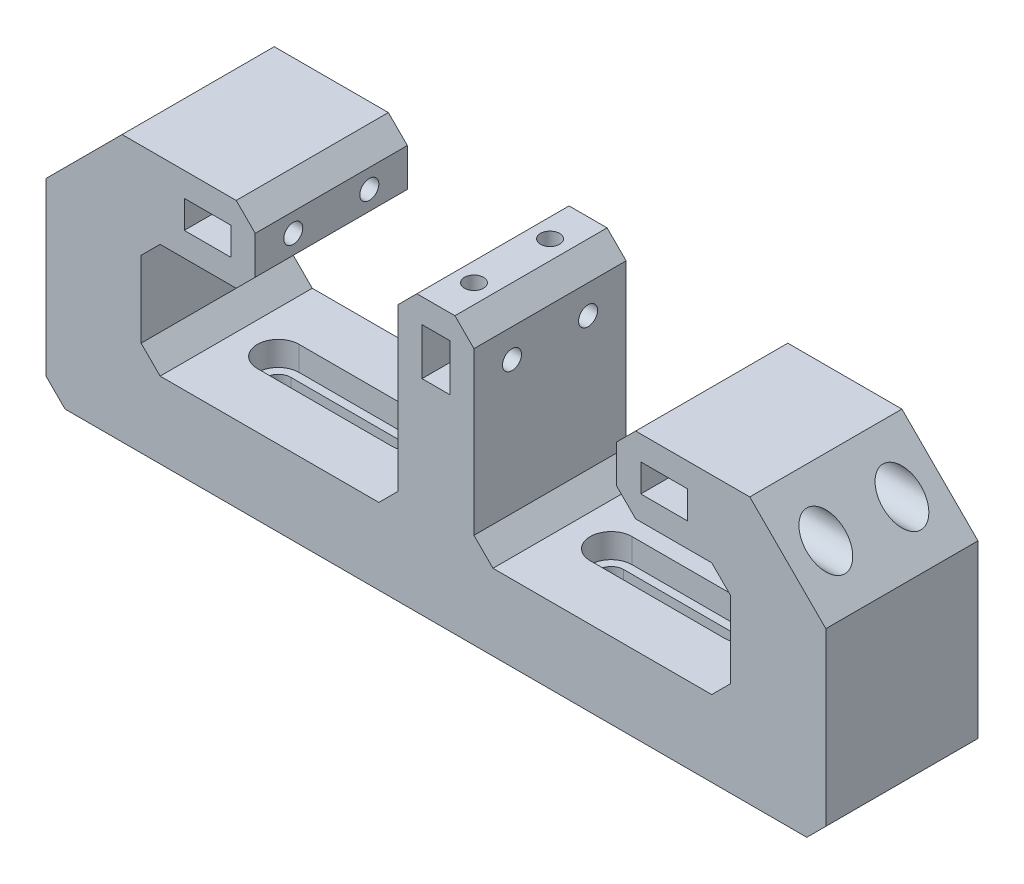
from build123d import *

# Parameters (mm, degrees)
SKETCH_1_W                  = 12.3
SKETCH_1_H                  = 7.3
SKETCH_1_W_2                = 7.3
SKETCH_1_H_2                = 12.3
EXTRUDE_1_DEPTH             = 40
CHAMFER_1_SIZE              = 5
CHAMFER_2_SIZE              = 5
CHAMFER_3_SIZE              = 5
SKETCH_25_R                 = 5
CUT_EXTRUDE_1452_DEPTH      = 15
SKETCH_26_R                 = 2.5
CUT_EXTRUDE_1599_DEPTH      = 132.766839531
SKETCH_23_R                 = 5
CUT_EXTRUDE_1755_DEPTH      = 25
CUT_EXTRUDE_1893_REACH      = 219.313
SKETCH_24_R                 = 2.5
MIRROR_2083_COPY_1_SKETCH_R = 5
MIRROR_2083_COPY_1_DEPTH    = 25
MIRROR_2083_COPY_2_REACH    = 219.313
MIRROR_2083_COPY_2_SKETCH_R = 2.5
HOLE_START                  = -60
HOLE_WIZARD_M6_2_DEPTH      = 20
HOLE_START_2                = -46.4
HOLE_WIZARD_M6_2_2_DEPTH    = 6.4


# Read off the part's stored shape, not the designer's step: M6 六角承窩頭蓋螺釘的柱孔2
with BuildPart() as part:
    # 草圖1 → 填料-伸長1 (new body)
    with BuildSketch(Plane.XY):
        Polygon((-82.5, 10), (-47.5, 10), (-47.5, -10), (-77.5, -10), (-77.5, -40), (-10, -40), (-10, 12.5), (10, 12.5), (10, -40), (77.5, -40), (77.5, -10), (47.5, -10), (47.5, 10), (82.5, 10), (102.5, -10), (102.5, -60), (-102.5, -60), (-102.5, -10), align=None)
        with Locations((60, 0)):
            Rectangle(SKETCH_1_W, SKETCH_1_H, mode=Mode.SUBTRACT)
        with Locations((-60, 0)):
            Rectangle(SKETCH_1_W, SKETCH_1_H, mode=Mode.SUBTRACT)
        Rectangle(SKETCH_1_W_2, SKETCH_1_H_2, mode=Mode.SUBTRACT)
    extrude(amount=EXTRUDE_1_DEPTH)

    # 導角1
    chamfer_1_edges = [part.edges().sort_by_distance(p)[0] for p in [
        (-47.5, -10, 20),
        (-10, 12.5, 20),
        (10, 12.5, 20),
        (47.5, -10, 20),
        (47.5, 10, 20),
        (-47.5, 10, 20),
    ]]
    chamfer(chamfer_1_edges, length=CHAMFER_1_SIZE)

    # 導角2
    chamfer_2_edges = [part.edges().sort_by_distance(p)[0] for p in [
        (-77.5, -10, 20),
        (-77.5, -40, 20),
        (-10, -40, 20),
        (10, -40, 20),
        (77.5, -40, 20),
        (77.5, -10, 20),
    ]]
    chamfer(chamfer_2_edges, length=CHAMFER_2_SIZE)

    # 導角3
    chamfer_3_edges = [part.edges().sort_by_distance(p)[0] for p in [
        (102.5, -60, 20),
        (-102.5, -60, 20),
    ]]
    chamfer(chamfer_3_edges, length=CHAMFER_3_SIZE)

    # 草圖25 → Cut-Extrude 1452 (cut)
    with BuildSketch(Plane(origin=(0, -60, 0), x_dir=(-1, 0, 0), z_dir=(0, -1, 0))):
        with Locations(Location((0, -10, 0), (0, 0, 180))):
            Circle(SKETCH_25_R)
    cut_extrude_1452 = extrude(amount=-CUT_EXTRUDE_1452_DEPTH, mode=Mode.SUBTRACT)

    # 草圖26 → Cut-Extrude 1599 (cut, through all)
    with BuildSketch(Plane(origin=(0, -60, 0), x_dir=(-1, 0, 0), z_dir=(0, -1, 0))):
        with Locations(Location((0, -10, 0), (0, 0, 180))):
            Circle(SKETCH_26_R)
    cut_extrude_1599 = extrude(amount=-CUT_EXTRUDE_1599_DEPTH, mode=Mode.SUBTRACT)

    # Mirror 1698: Cut-Extrude 1452, Cut-Extrude 1599 across plane
    add(cut_extrude_1452.mirror(Plane(origin=(0, 0, 20), x_dir=(1, 0, 0), z_dir=(0, 0, -1))), mode=Mode.SUBTRACT)
    add(cut_extrude_1599.mirror(Plane(origin=(0, 0, 20), x_dir=(1, 0, 0), z_dir=(0, 0, -1))), mode=Mode.SUBTRACT)

    # 草圖23 → Cut-Extrude 1755 (cut)
    with BuildSketch(Plane(origin=(102.5, 0, 0), x_dir=(0, 0, -1), z_dir=(1, 0, 0))):
        with Locations(Location((-10, 0, 0), (0, 0, 90))):
            Circle(SKETCH_23_R)
    cut_extrude_1755 = extrude(amount=-CUT_EXTRUDE_1755_DEPTH, mode=Mode.SUBTRACT)

    # Cut-Extrude 1893: up to this face of the body (flat: up to its plane)
    cut_extrude_1893_end = Plane(part.part.faces().sort_by_distance((3.65, 0, 20))[0])
    # 草圖24 → Cut-Extrude 1893 (cut, up to the picked face)
    with BuildSketch(Plane(origin=(102.5, 0, 0), x_dir=(0, 0, -1), z_dir=(1, 0, 0)), mode=Mode.PRIVATE) as cut_extrude_1893_sk1:
        with Locations(Location((-10, 0, 0), (0, 0, 90))):
            Circle(SKETCH_24_R)
    cut_extrude_1893_tool1 = split(extrude(cut_extrude_1893_sk1.sketch, amount=-CUT_EXTRUDE_1893_REACH, mode=Mode.PRIVATE), bisect_by=cut_extrude_1893_end, keep=Keep.BOTH, mode=Mode.PRIVATE)
    cut_extrude_1893 = cut_extrude_1893_tool1.solids().sort_by(Axis((102.5, 0, 10), (-1, 0, 0)))[0]
    add(cut_extrude_1893, mode=Mode.SUBTRACT)

    # Mirror 2006: Cut-Extrude 1755, Cut-Extrude 1893 across plane
    add(cut_extrude_1755.mirror(Plane.ZY), mode=Mode.SUBTRACT)
    add(cut_extrude_1893.mirror(Plane.ZY), mode=Mode.SUBTRACT)

    # Mirror 2083: Cut-Extrude 1755, Cut-Extrude 1893 across plane
    add(cut_extrude_1755.mirror(Plane(origin=(0, 0, 20), x_dir=(1, 0, 0), z_dir=(0, 0, -1))), mode=Mode.SUBTRACT)
    add(cut_extrude_1893.mirror(Plane(origin=(0, 0, 20), x_dir=(1, 0, 0), z_dir=(0, 0, -1))), mode=Mode.SUBTRACT)

    # Mirror 2083 copy 1 sketch → Mirror 2083 copy 1 (cut)
    with BuildSketch(Plane(origin=(-102.5, 0, 40), x_dir=(0, 0, 1), z_dir=(-1, 0, 0))):
        with Locations(Location((-10, 0, 0), (0, 0, 90))):
            Circle(MIRROR_2083_COPY_1_SKETCH_R)
    extrude(amount=-MIRROR_2083_COPY_1_DEPTH, mode=Mode.SUBTRACT)

    # Mirror 2083 copy 2: up to this face of the body (flat: up to its plane)
    mirror_2083_copy_2_end = Plane(part.part.faces().sort_by_distance((-3.65, 0, 20))[0])
    # Mirror 2083 copy 2 sketch → Mirror 2083 copy 2 (cut, up to the picked face)
    with BuildSketch(Plane(origin=(-102.5, 0, 40), x_dir=(0, 0, 1), z_dir=(-1, 0, 0)), mode=Mode.PRIVATE) as mirror_2083_copy_2_sk1:
        with Locations(Location((-10, 0, 0), (0, 0, 90))):
            Circle(MIRROR_2083_COPY_2_SKETCH_R)
    mirror_2083_copy_2_tool1 = split(extrude(mirror_2083_copy_2_sk1.sketch, amount=-MIRROR_2083_COPY_2_REACH, mode=Mode.PRIVATE), bisect_by=mirror_2083_copy_2_end, keep=Keep.BOTH, mode=Mode.PRIVATE)
    add(mirror_2083_copy_2_tool1.solids().sort_by(Axis((-102.5, 0, 30), (1, 0, 0)))[0], mode=Mode.SUBTRACT)

    # M6 六角承窩頭蓋螺釘的柱孔2 outline → M6 六角承窩頭蓋螺釘的柱孔2 (cut)
    with BuildSketch(Plane(origin=(0, 0, 0), x_dir=(1, 0, 0), z_dir=(0, 1, 0)).offset(HOLE_START)):
        with BuildLine():
            Line((26.05, -23.3), (61.45, -23.3))
            ThreePointArc((61.45, -23.3), (64.75, -20), (61.45, -16.7))
            Line((61.45, -16.7), (26.05, -16.7))
            ThreePointArc((26.05, -16.7), (22.75, -20), (26.05, -23.3))
        make_face()
    hole_wizard_m6_2 = extrude(amount=HOLE_WIZARD_M6_2_DEPTH, mode=Mode.SUBTRACT)

    # Hole Wizard M6 _2 2 outline → Hole Wizard M6 _2 2 (cut)
    with BuildSketch(Plane(origin=(0, 0, 0), x_dir=(1, 0, 0), z_dir=(0, 1, 0)).offset(HOLE_START_2)):
        with BuildLine():
            Line((26.05, -25.5), (61.45, -25.5))
            ThreePointArc((61.45, -25.5), (66.95, -20), (61.45, -14.5))
            Line((61.45, -14.5), (26.05, -14.5))
            ThreePointArc((26.05, -14.5), (20.55, -20), (26.05, -25.5))
        make_face()
        with BuildLine():
            ThreePointArc((61.45, -16.7), (64.75, -20), (61.45, -23.3))
            Line((61.45, -23.3), (26.05, -23.3))
            ThreePointArc((26.05, -23.3), (22.75, -20), (26.05, -16.7))
            Line((26.05, -16.7), (61.45, -16.7))
        make_face(mode=Mode.SUBTRACT)
    hole_wizard_m6_2_2 = extrude(amount=HOLE_WIZARD_M6_2_2_DEPTH, mode=Mode.SUBTRACT)

    # Mirror 2781: M6 六角承窩頭蓋螺釘的柱孔2, Hole Wizard M6 _2 2 across plane
    add(hole_wizard_m6_2.mirror(Plane.ZY), mode=Mode.SUBTRACT)
    add(hole_wizard_m6_2_2.mirror(Plane.ZY), mode=Mode.SUBTRACT)


solid = part.part
